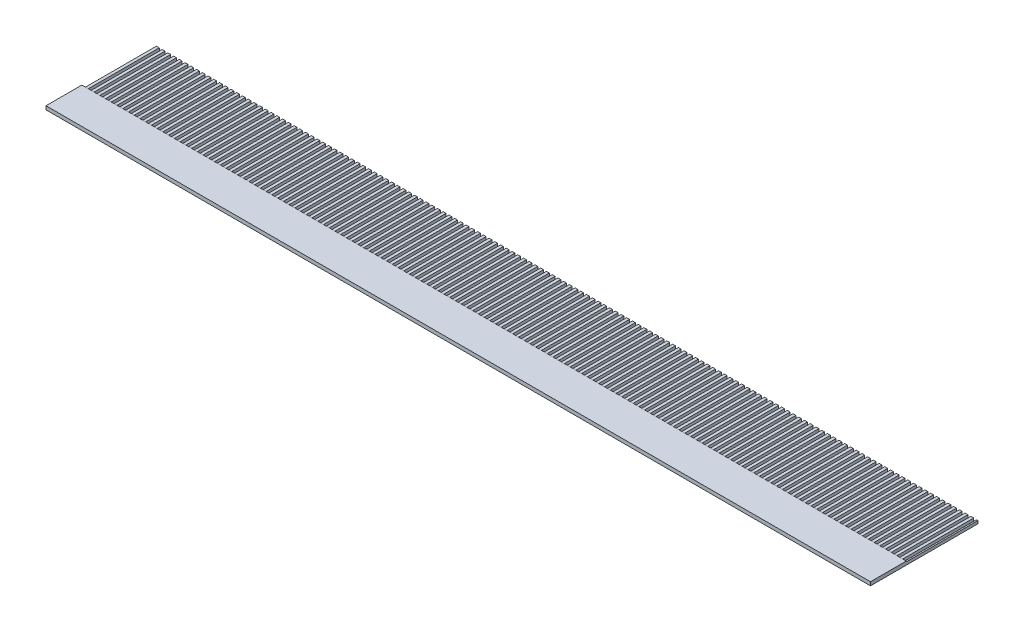
from build123d import *

# Parameters (mm, degrees)
SKETCH1_W           = 115
SKETCH1_H           = 15
BOSS_EXTRUDE1_DEPTH = 0.5
SKETCH2_W           = 115
SKETCH2_H           = 10
CUT_EXTRUDE1_DEPTH  = 0.1
SKETCH3_W           = 0.4
SKETCH3_H           = 10
CUT_EXTRUDE2_DEPTH  = 0.4
LPATTERN3_COUNT     = 150
LPATTERN3_PITCH     = 0.8


with BuildPart() as part:
    # Sketch1 → Boss-Extrude1 (new body)
    with BuildSketch(Plane(origin=(0, 0, 0), x_dir=(1, 0, 0), z_dir=(0, 1, 0))):
        with Locations((57.5, 7.5)):
            Rectangle(SKETCH1_W, SKETCH1_H)
    extrude(amount=BOSS_EXTRUDE1_DEPTH)

    # Sketch2 → Cut-Extrude1 (cut)
    with BuildSketch(Plane(origin=(0, 0.5, 0), x_dir=(1, 0, 0), z_dir=(0, 1, 0))):
        with Locations((57.5, 10)):
            Rectangle(SKETCH2_W, SKETCH2_H)
    extrude(amount=-CUT_EXTRUDE1_DEPTH, mode=Mode.SUBTRACT)

    # Sketch3 → Cut-Extrude2 (cut)
    with BuildSketch(Plane(origin=(0, 0.4, 0), x_dir=(1, 0, 0), z_dir=(0, 1, 0))):
        with Locations((0.2, 10)):
            Rectangle(SKETCH3_W, SKETCH3_H)
    cut_extrude2 = extrude(amount=-CUT_EXTRUDE2_DEPTH, mode=Mode.SUBTRACT)

    # LPattern3: Cut-Extrude2 ×150
    with Locations(*[(i * LPATTERN3_PITCH, 0, 0) for i in range(1, LPATTERN3_COUNT)]):
        add(cut_extrude2, mode=Mode.SUBTRACT)


solid = part.part
